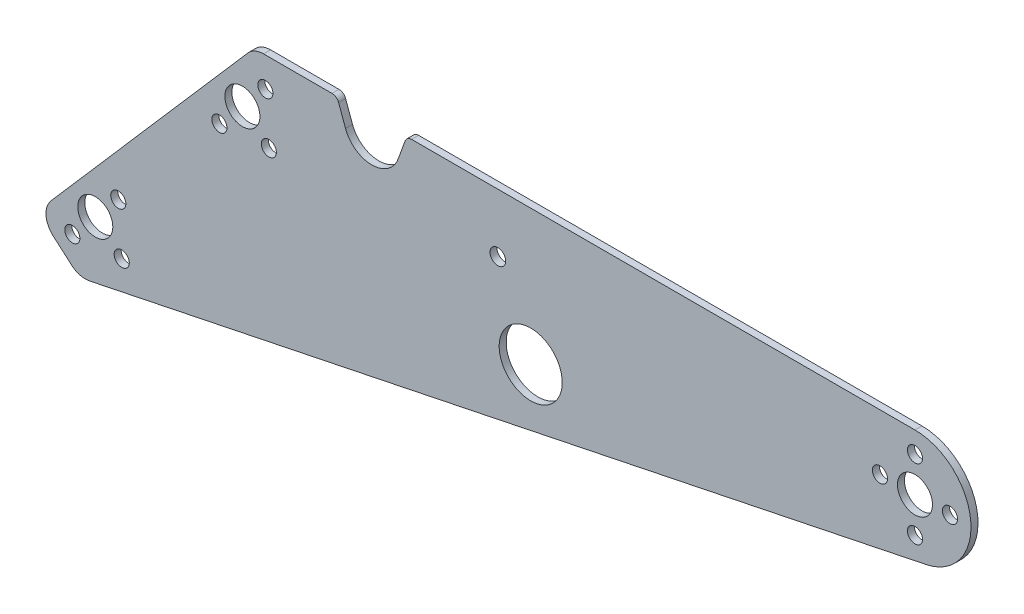
from build123d import *

# Parameters (mm, degrees)
SKETCH1_R           = 7.9375
SKETCH1_R_2         = 3.429
SKETCH1_R_3         = 14.2875
SKETCH1_R_4         = 3.556
BOSS_EXTRUDE1_DEPTH = 3.175


with BuildPart() as part:
    # Sketch1 → Boss-Extrude1 (new body)
    with BuildSketch(Plane.XY):
        with BuildLine():
            Line((304.8, 25.4), (76.724364717, 25.4))
            ThreePointArc((76.724364717, 25.4), (74.903259532, 24.825807741), (73.740840646, 23.310913955))
            Line((73.740840646, 23.310913955), (70.609033369, 14.70634418))
            ThreePointArc((70.609033369, 14.70634418), (58.674937085, 6.35), (46.740840801, 14.70634418))
            Line((46.740840801, 14.70634418), (43.609033524, 23.310913955))
            ThreePointArc((43.609033524, 23.310913955), (42.446614639, 24.825807741), (40.625509453, 25.4))
            Line((40.625509453, 25.4), (9.593010709, 25.4))
            ThreePointArc((9.593010709, 25.4), (5.643057573, 24.542381105), (2.404401957, 22.123962251))
            Line((2.404401957, 22.123962251), (-86.655346099, -80.327558268))
            ThreePointArc((-86.655346099, -80.327558268), (-88.968534927, -87.240950932), (-85.715699599, -93.765129271))
            Line((-85.715699599, -93.765129271), (-77.389837916, -101.002690413))
            ThreePointArc((-77.389837916, -101.002690413), (-73.552808487, -103.028646494), (-69.21525712, -103.142405102))
            Line((-69.21525712, -103.142405102), (309.934982787, -24.875529176))
            ThreePointArc((309.934982787, -24.875529176), (330.068542113, 2.580848594), (304.8, 25.4))
        make_face()
        with Locations((304.8, 0)):
            Circle(SKETCH1_R, mode=Mode.SUBTRACT)
        Circle(SKETCH1_R, mode=Mode.SUBTRACT)
        with Locations((-66.655597345, -76.678493351)):
            Circle(SKETCH1_R, mode=Mode.SUBTRACT)
        with Locations((304.8, 15.875)):
            Circle(SKETCH1_R_2, mode=Mode.SUBTRACT)
        with Locations((320.675, 0)):
            Circle(SKETCH1_R_2, mode=Mode.SUBTRACT)
        with Locations((304.8, -15.875)):
            Circle(SKETCH1_R_2, mode=Mode.SUBTRACT)
        with Locations((288.925, 0)):
            Circle(SKETCH1_R_2, mode=Mode.SUBTRACT)
        with Locations((-56.24066026, -64.697478765)):
            Circle(SKETCH1_R_2, mode=Mode.SUBTRACT)
        with Locations((-54.674582759, -87.093430436)):
            Circle(SKETCH1_R_2, mode=Mode.SUBTRACT)
        with Locations((-77.070534431, -88.659507937)):
            Circle(SKETCH1_R_2, mode=Mode.SUBTRACT)
        with Locations((-10.414937085, -11.981014586)):
            Circle(SKETCH1_R_2, mode=Mode.SUBTRACT)
        with Locations((11.981014586, -10.414937085)):
            Circle(SKETCH1_R_2, mode=Mode.SUBTRACT)
        with Locations((10.414937085, 11.981014586)):
            Circle(SKETCH1_R_2, mode=Mode.SUBTRACT)
        with Locations((130.671295769, -35.944879509)):
            Circle(SKETCH1_R_3, mode=Mode.SUBTRACT)
        with Locations((115.786625943, -1.087398892)):
            Circle(SKETCH1_R_4, mode=Mode.SUBTRACT)
    extrude(amount=BOSS_EXTRUDE1_DEPTH)


solid = part.part
